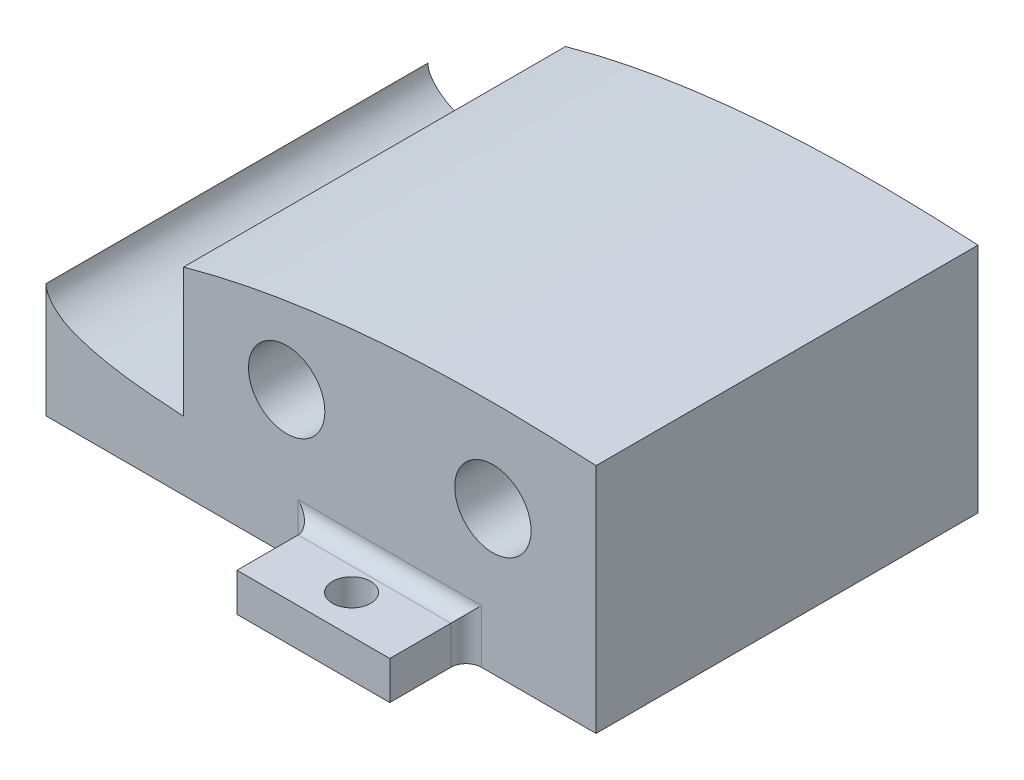
from build123d import *

# Parameters (mm, degrees)
BOSS_EXTRUDE2_DEPTH      = 31.75
BOSS_EXTRUDE2_DEPTH_BACK = 31.75
SKETCH6_R                = 6.35
SKETCH7_W                = 25.4
SKETCH7_H                = 12.7
SKETCH7_R                = 3.175
BOSS_EXTRUDE3_DEPTH      = 6.35
FILLET2_R                = 2.54


with BuildPart() as part:
    # Sketch6 → Boss-Extrude2 (new, two sides: drawn at the far end of the back side and taken through both)
    with BuildSketch(Plane.XY.offset(-BOSS_EXTRUDE2_DEPTH_BACK)):
        with BuildLine():
            Line((0, 0), (0, -19.05))
            Line((0, -19.05), (91.44, -19.05))
            Line((91.44, -19.05), (91.44, 19.508873689))
            add(Edge.make_bspline(
                [(91.44, 19.508873689), (84.035620806, 19.934056268), (72.792017375, 20.223197155), (57.72640102, 19.576586177), (46.241137994, 18.487194162), (34.713862172, 16.738987134), (26.950784486, 14.94277721), (23.006436851, 13.850652949), (22.86, 13.80984362)],
                knots=[0.299041321, 0.299041321, 0.299041321, 0.299041321, 0.346600594, 0.371102737, 0.395726297, 0.420570145, 0.445825119, 0.446799337, 0.446799337, 0.446799337, 0.446799337], degree=3))
            Line((22.86, 13.80984362), (22.86, -7.674303273))
            add(Edge.make_bspline(
                [(0, 0), (0, -0.17867716), (0.134938936, -1.688448649), (2.416021962, -3.935922156), (6.457030189, -5.50998662), (11.289417386, -6.62752917), (17.013896112, -7.281283102), (20.870897646, -7.562814069), (22.817971884, -7.671962522), (22.86, -7.674303273)],
                knots=[0.505625693, 0.505625693, 0.505625693, 0.505625693, 0.506863029, 0.51614777, 0.522766003, 0.535269014, 0.547551134, 0.559786371, 0.560056294, 0.560056294, 0.560056294, 0.560056294], degree=3))
        make_face()
        with Locations((40.005, 4.734594188)):
            Circle(SKETCH6_R, mode=Mode.SUBTRACT)
        with Locations((74.295, 4.734594188)):
            Circle(SKETCH6_R, mode=Mode.SUBTRACT)
    extrude(amount=BOSS_EXTRUDE2_DEPTH + BOSS_EXTRUDE2_DEPTH_BACK)

    # Sketch7 → Boss-Extrude3 (add)
    # profile 1 of 2: a face of its own
    with BuildSketch(Plane.XZ.offset(19.05)):
        with Locations((57.15, 38.1)):
            Rectangle(SKETCH7_W, SKETCH7_H)
        with Locations((57.15, 38.1)):
            Circle(SKETCH7_R, mode=Mode.SUBTRACT)
    # profile 2 of 2: a face of its own
    with BuildSketch(Plane.XZ.offset(19.05)):
        with Locations((57.15, -38.1)):
            Rectangle(SKETCH7_W, SKETCH7_H)
        with Locations((57.15, -38.1)):
            Circle(SKETCH7_R, mode=Mode.SUBTRACT)
    extrude(amount=-BOSS_EXTRUDE3_DEPTH)

    # Fillet2
    fillet2_edges = [part.edges().sort_by_distance(p)[0] for p in [
        (57.15, -12.7, 31.75),
        (44.45, -15.875, 31.75),
        (69.85, -15.875, 31.75),
        (57.15, -12.7, -31.75),
        (69.85, -15.875, -31.75),
        (44.45, -15.875, -31.75),
    ]]
    fillet(fillet2_edges, radius=FILLET2_R)


solid = part.part
